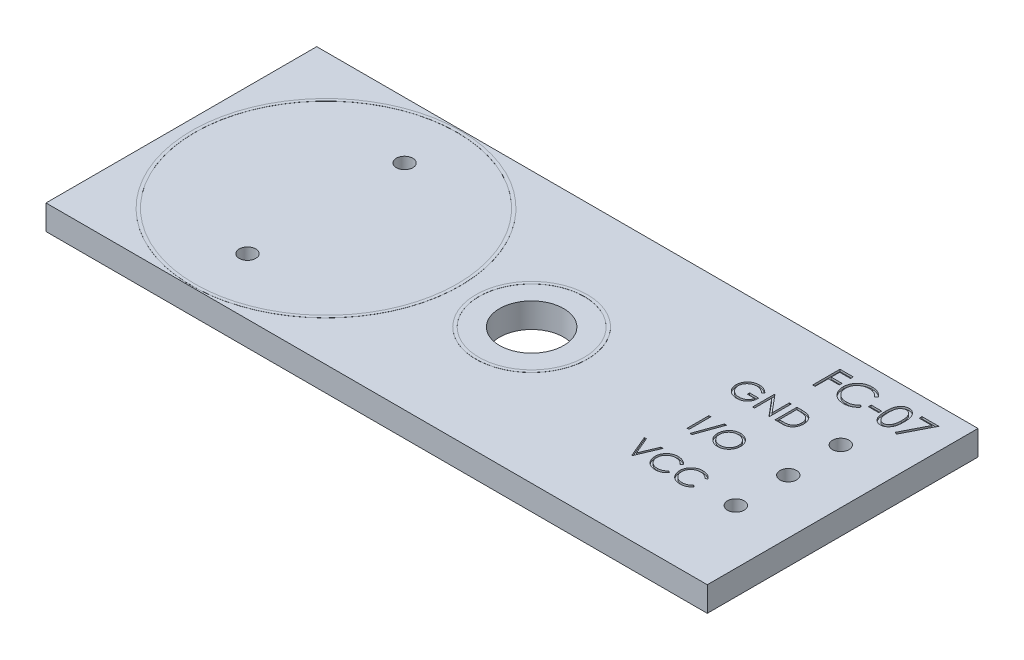
from build123d import *

# Parameters (mm, degrees)
SKETCH1_W           = 32
SKETCH1_H           = 13.1
BOSS_EXTRUDE1_DEPTH = 1.2
CUT_EXTRUDE1_REACH  = 19.33
SKETCH2_R           = 1.55
CUT_EXTRUDE2_REACH  = 19.33
SKETCH4_R           = 0.4
CUT_EXTRUDE3_REACH  = 19.33
SKETCH5_R           = 0.4
SKETCH6_W           = 0.094978632
SKETCH6_H           = 1.058333333
CUT_EXTRUDE4_DEPTH  = 0.1
SKETCH7_W           = 0.508814102
SKETCH7_H           = 0.13568376
CUT_EXTRUDE5_DEPTH  = 0.1
SKETCH8_R           = 6.5
SKETCH8_R_2         = 6.35
SKETCH8_R_3         = 2.7
SKETCH8_R_4         = 2.55
BOSS_EXTRUDE2_DEPTH = 0.005


with BuildPart() as part:
    # Sketch1 → Boss-Extrude1 (new body)
    with BuildSketch(Plane(origin=(0, 0, 0), x_dir=(1, 0, 0), z_dir=(0, 1, 0))):
        Rectangle(SKETCH1_W, SKETCH1_H)
    extrude(amount=BOSS_EXTRUDE1_DEPTH)

    # Sketch2 → Cut-Extrude1 (cut, up to next)
    with BuildSketch(Plane(origin=(0, 1.2, 0), x_dir=(1, 0, 0), z_dir=(0, 1, 0)), mode=Mode.PRIVATE) as cut_extrude1_sk1:
        with Locations((0.95, 0)):
            Circle(SKETCH2_R)
    cut_extrude1_tool1 = extrude(cut_extrude1_sk1.sketch, amount=-CUT_EXTRUDE1_REACH, mode=Mode.PRIVATE) & part.part
    add(cut_extrude1_tool1.solids().sort_by_distance((0.95, 1.2, 0))[0], mode=Mode.SUBTRACT)

    # Sketch4 → Cut-Extrude2 (cut, up to next)
    with BuildSketch(Plane(origin=(0, 1.2, 0), x_dir=(1, 0, 0), z_dir=(0, 1, 0)), mode=Mode.PRIVATE) as cut_extrude2_sk1:
        with Locations((13.37, 0)):
            Circle(SKETCH4_R)
    cut_extrude2_tool1 = extrude(cut_extrude2_sk1.sketch, amount=-CUT_EXTRUDE2_REACH, mode=Mode.PRIVATE) & part.part
    # Sketch4 → Cut-Extrude2 (cut, up to next)
    with BuildSketch(Plane(origin=(0, 1.2, 0), x_dir=(1, 0, 0), z_dir=(0, 1, 0)), mode=Mode.PRIVATE) as cut_extrude2_sk2:
        with Locations((13.37, 2.54)):
            Circle(SKETCH4_R)
    cut_extrude2_tool2 = extrude(cut_extrude2_sk2.sketch, amount=-CUT_EXTRUDE2_REACH, mode=Mode.PRIVATE) & part.part
    # Sketch4 → Cut-Extrude2 (cut, up to next)
    with BuildSketch(Plane(origin=(0, 1.2, 0), x_dir=(1, 0, 0), z_dir=(0, 1, 0)), mode=Mode.PRIVATE) as cut_extrude2_sk3:
        with Locations((13.37, -2.54)):
            Circle(SKETCH4_R)
    cut_extrude2_tool3 = extrude(cut_extrude2_sk3.sketch, amount=-CUT_EXTRUDE2_REACH, mode=Mode.PRIVATE) & part.part
    add(cut_extrude2_tool1.solids().sort_by_distance((13.37, 1.2, 0))[0], mode=Mode.SUBTRACT)
    add(cut_extrude2_tool2.solids().sort_by_distance((13.37, 1.2, -2.54))[0], mode=Mode.SUBTRACT)
    add(cut_extrude2_tool3.solids().sort_by_distance((13.37, 1.2, 2.54))[0], mode=Mode.SUBTRACT)

    # Sketch5 → Cut-Extrude3 (cut, up to next)
    with BuildSketch(Plane(origin=(0, 1.2, 0), x_dir=(1, 0, 0), z_dir=(0, 1, 0)), mode=Mode.PRIVATE) as cut_extrude3_sk1:
        with Locations((-9, -3.8)):
            Circle(SKETCH5_R)
    cut_extrude3_tool1 = extrude(cut_extrude3_sk1.sketch, amount=-CUT_EXTRUDE3_REACH, mode=Mode.PRIVATE) & part.part
    # Sketch5 → Cut-Extrude3 (cut, up to next)
    with BuildSketch(Plane(origin=(0, 1.2, 0), x_dir=(1, 0, 0), z_dir=(0, 1, 0)), mode=Mode.PRIVATE) as cut_extrude3_sk2:
        with Locations((-9, 3.8)):
            Circle(SKETCH5_R)
    cut_extrude3_tool2 = extrude(cut_extrude3_sk2.sketch, amount=-CUT_EXTRUDE3_REACH, mode=Mode.PRIVATE) & part.part
    add(cut_extrude3_tool1.solids().sort_by_distance((-9, 1.2, 3.8))[0], mode=Mode.SUBTRACT)
    add(cut_extrude3_tool2.solids().sort_by_distance((-9, 1.2, -3.8))[0], mode=Mode.SUBTRACT)

    # Sketch6 → Cut-Extrude4 (cut)
    # profile 1 of 9: a face of its own
    with BuildSketch(Plane(origin=(0, 1.2, 0), x_dir=(1, 0, 0), z_dir=(0, 1, 0))):
        with BuildLine():
            Line((9.359822658, 2.876299306), (9.278412401, 2.799129167))
            add(Edge.make_bspline(
                [(9.278412401, 2.799129167), (9.263680738, 2.812987547), (9.234568695, 2.840373846), (9.187106907, 2.875906933), (9.137587904, 2.906346444), (9.086270077, 2.93111333), (9.034424276, 2.95087476), (8.98273867, 2.964943983), (8.931743422, 2.973916393), (8.897826192, 2.974989353), (8.88111339, 2.975518056)],
                knots=[0, 0, 0, 0, 1.08915593, 2.152340314, 3.188132944, 4.216796309, 5.218260357, 6.173443236, 7.099959455, 8, 8, 8, 8], degree=3))
            add(Edge.make_bspline(
                [(8.88111339, 2.975518056), (8.87085823, 2.97539299), (8.850374509, 2.975143181), (8.81994835, 2.971954811), (8.789841295, 2.967369245), (8.760110179, 2.960734439), (8.730697195, 2.952325509), (8.70170464, 2.941807048), (8.67307843, 2.929543914), (8.64508821, 2.915373595), (8.617952391, 2.89980707), (8.592323539, 2.882556678), (8.568038297, 2.864175306), (8.54555312, 2.844202748), (8.524738671, 2.822819919), (8.505099521, 2.800424586), (8.487326386, 2.776404889), (8.471272629, 2.751202759), (8.456951378, 2.725260835), (8.444309237, 2.698828812), (8.433696546, 2.671994361), (8.425299592, 2.644723809), (8.418371847, 2.617228131), (8.413498189, 2.589316941), (8.410750537, 2.560960356), (8.410275261, 2.541971661), (8.410036333, 2.532425775)],
                knots=[0, 0, 0, 0, 1.02818874, 2.053710826, 3.065248034, 4.081641283, 5.106893873, 6.131558223, 7.173050175, 8.228653731, 9.27666206, 10.308777013, 11.325269123, 12.329503258, 13.32196095, 14.316845687, 15.314881793, 16.315733098, 17.311955233, 18.285320748, 19.252783886, 20.203351036, 21.145449891, 22.095197417, 23.042428769, 24, 24, 24, 24], degree=3))
            add(Edge.make_bspline(
                [(8.410036333, 2.532425775), (8.410264848, 2.522667695), (8.410721253, 2.50317818), (8.41364235, 2.474090925), (8.419063508, 2.445435672), (8.426310887, 2.41711826), (8.435376515, 2.389090192), (8.446677297, 2.361472981), (8.460062371, 2.334267649), (8.475555329, 2.307719321), (8.492544967, 2.281858788), (8.511577755, 2.257499123), (8.531795122, 2.234315945), (8.553933611, 2.212823988), (8.57728333, 2.192448382), (8.602541899, 2.173750498), (8.629212643, 2.156370178), (8.657336252, 2.140526468), (8.68660757, 2.126372459), (8.716620921, 2.113786185), (8.747472189, 2.103420767), (8.778999241, 2.094972816), (8.811164492, 2.088048202), (8.844131213, 2.083593381), (8.877657008, 2.080360677), (8.900256547, 2.080124315), (8.911642236, 2.080005236)],
                knots=[0, 0, 0, 0, 0.93586088, 1.869166235, 2.799637598, 3.729985548, 4.670839027, 5.622275134, 6.589130586, 7.576015415, 8.568469353, 9.55398029, 10.53834874, 11.515998671, 12.510579167, 13.508179873, 14.527009472, 15.561807829, 16.601455013, 17.643573243, 18.680854198, 19.719860599, 20.772568776, 21.833555941, 22.908541556, 24, 24, 24, 24], degree=3))
            add(Edge.make_bspline(
                [(8.911642236, 2.080005236), (8.925363784, 2.080292067), (8.952308272, 2.080855307), (8.991916077, 2.085239918), (9.02995653, 2.092087877), (9.066322739, 2.102116613), (9.101056943, 2.114908438), (9.134286475, 2.130328472), (9.165749715, 2.148968159), (9.195541246, 2.170005971), (9.22298449, 2.19344498), (9.247735618, 2.21873747), (9.269399849, 2.245760671), (9.28830008, 2.274355421), (9.303935792, 2.304758406), (9.316769685, 2.336820633), (9.326607132, 2.370556524), (9.330645422, 2.393867565), (9.332685906, 2.405646261)],
                knots=[0, 0, 0, 0, 1.13008108, 2.219097802, 3.278683437, 4.311054135, 5.322181354, 6.324827112, 7.324222904, 8.330512327, 9.32562643, 10.293043162, 11.24128371, 12.174520618, 13.111833804, 14.052305215, 15.015860969, 16, 16, 16, 16], degree=3))
            Line((9.332685906, 2.405646261), (8.979908128, 2.405646261))
            Line((8.979908128, 2.405646261), (8.979908128, 2.51419327))
            Line((8.979908128, 2.51419327), (9.427664538, 2.51419327))
            add(Edge.make_bspline(
                [(9.427664538, 2.51419327), (9.427148722, 2.49396172), (9.426139177, 2.454364921), (9.419057743, 2.396619149), (9.40762275, 2.342078184), (9.392001655, 2.290684589), (9.371779845, 2.242511193), (9.347174342, 2.197509086), (9.317791343, 2.155968994), (9.284677472, 2.117551796), (9.247514866, 2.0832832), (9.207307688, 2.053164262), (9.163989509, 2.027793709), (9.117601305, 2.007152985), (9.068294936, 1.991043944), (9.015956307, 1.979622539), (8.960656394, 1.972779669), (8.922756971, 1.971905371), (8.903374007, 1.971458227)],
                knots=[0, 0, 0, 0, 1.140356446, 2.231883559, 3.274166699, 4.278491846, 5.25512956, 6.21435461, 7.1637429, 8.11826594, 9.068280886, 10.0076534, 10.945064095, 11.891975133, 12.864533718, 13.863980011, 14.907571808, 16, 16, 16, 16], degree=3))
            add(Edge.make_bspline(
                [(8.903374007, 1.971458227), (8.891426894, 1.971630318), (8.867863338, 1.971969738), (8.833062034, 1.974381936), (8.799220277, 1.978095348), (8.766342998, 1.983703041), (8.734309261, 1.990571519), (8.703279053, 1.999366789), (8.67313417, 2.009547562), (8.643828017, 2.021127445), (8.615626594, 2.034544588), (8.58840429, 2.049454884), (8.562010629, 2.065781448), (8.536625395, 2.083806632), (8.512116324, 2.103395614), (8.488641449, 2.124587656), (8.466069353, 2.147317971), (8.451929879, 2.163458767), (8.444805297, 2.171591774)],
                knots=[0, 0, 0, 0, 1.107784379, 2.184907829, 3.233506516, 4.263428166, 5.276301166, 6.270063455, 7.25232949, 8.225834625, 9.190232166, 10.146266622, 11.1027726, 12.066435141, 13.031522626, 14.010570082, 14.99756817, 16, 16, 16, 16], degree=3))
            add(Edge.make_bspline(
                [(8.444805297, 2.171591774), (8.434468122, 2.184494567), (8.413965359, 2.210085979), (8.387574107, 2.251088819), (8.36507654, 2.293543668), (8.34682246, 2.33756871), (8.332568801, 2.383122767), (8.322346434, 2.430147629), (8.316357087, 2.478703851), (8.315494232, 2.511562157), (8.3150577, 2.528185658)],
                knots=[0, 0, 0, 0, 1.023165419, 2.029347347, 3.013907458, 3.994755782, 4.975994455, 5.96558838, 6.970761222, 8, 8, 8, 8], degree=3))
            add(Edge.make_bspline(
                [(8.3150577, 2.528185658), (8.315218639, 2.540633548), (8.315538471, 2.565371125), (8.319416663, 2.602097501), (8.324980901, 2.638171758), (8.333159415, 2.673564407), (8.343469476, 2.708299086), (8.35633684, 2.742391923), (8.371318273, 2.775863036), (8.38873103, 2.808482039), (8.40810895, 2.839816088), (8.429139612, 2.869739043), (8.452121653, 2.897705974), (8.476679763, 2.924071068), (8.503106949, 2.9485031), (8.531155631, 2.971228272), (8.560847428, 2.992277066), (8.592275749, 3.011317944), (8.624971501, 3.028421706), (8.658856311, 3.043416539), (8.693919835, 3.055809113), (8.729899382, 3.066324042), (8.767067293, 3.07409981), (8.805153848, 3.079738836), (8.844357573, 3.083597398), (8.870857039, 3.083907718), (8.884293478, 3.084065065)],
                knots=[0, 0, 0, 0, 1.008945113, 2.00506715, 2.99143336, 3.967273523, 4.948097931, 5.927297278, 6.919902385, 7.919676788, 8.923139349, 9.905703106, 10.883022732, 11.856032218, 12.825136022, 13.798837087, 14.781400844, 15.773989409, 16.776158564, 17.77167057, 18.775803737, 19.789618931, 20.80898985, 21.851988756, 22.910860228, 24, 24, 24, 24], degree=3))
            add(Edge.make_bspline(
                [(8.884293478, 3.084065065), (8.895251232, 3.083889837), (8.916979172, 3.083542382), (8.949311477, 3.081134024), (8.981144031, 3.077316803), (9.012524035, 3.072107751), (9.043344627, 3.065012778), (9.073693607, 3.05652244), (9.103614969, 3.046637055), (9.133014939, 3.034847571), (9.162091201, 3.021466117), (9.191005424, 3.006403487), (9.219658815, 2.989402117), (9.248101064, 2.970411524), (9.276511526, 2.949757871), (9.304440835, 2.926850451), (9.332563154, 2.902592618), (9.350646083, 2.885150624), (9.359822658, 2.876299306)],
                knots=[0, 0, 0, 0, 0.985871117, 1.954866573, 2.915460327, 3.869826059, 4.81536089, 5.759505086, 6.70452669, 7.649098992, 8.607881297, 9.583363685, 10.581137262, 11.603961102, 12.659522466, 13.73993555, 14.853081303, 16, 16, 16, 16], degree=3))
        make_face()
    # profile 2 of 9: a face of its own
    with BuildSketch(Plane(origin=(0, 1.2, 0), x_dir=(1, 0, 0), z_dir=(0, 1, 0))):
        Polygon((9.644758555, 1.998594979), (9.644758555, 3.056928312), (9.664687108, 3.056928312), (10.363882487, 2.223957225), (10.363882487, 3.056928312), (10.458861119, 3.056928312), (10.458861119, 1.998594979), (10.43723652, 1.998594979), (9.739737188, 2.829658013), (9.739737188, 1.998594979), align=None)
    # profile 3 of 9: a face of its own
    with BuildSketch(Plane(origin=(0, 1.2, 0), x_dir=(1, 0, 0), z_dir=(0, 1, 0))):
        with BuildLine():
            Line((10.730228641, 1.998594979), (10.730228641, 3.056928312))
            Line((10.730228641, 3.056928312), (10.943930564, 3.056928312))
            add(Edge.make_bspline(
                [(10.943930564, 3.056928312), (10.962517615, 3.056794488), (10.998427701, 3.056535939), (11.050320036, 3.054896614), (11.098333222, 3.051996639), (11.142309348, 3.047772521), (11.182369143, 3.04258577), (11.218400437, 3.036084457), (11.250589537, 3.028407558), (11.270386249, 3.021862386), (11.279747871, 3.018767255)],
                knots=[0, 0, 0, 0, 1.314313732, 2.53924729, 3.670748893, 4.714932338, 5.66265055, 6.526160246, 7.303039223, 8, 8, 8, 8], degree=3))
            add(Edge.make_bspline(
                [(11.279747871, 3.018767255), (11.291992709, 3.014101303), (11.316204713, 3.004875209), (11.350678295, 2.987471279), (11.38313144, 2.96775208), (11.413738182, 2.945691616), (11.441799384, 2.920665254), (11.468411296, 2.893736088), (11.492485272, 2.863924851), (11.514531352, 2.831849795), (11.534408563, 2.79788877), (11.551686356, 2.762106487), (11.56603554, 2.724684665), (11.577947301, 2.68572737), (11.587335158, 2.645148942), (11.593740171, 2.60290213), (11.597964732, 2.559153899), (11.598389291, 2.529467811), (11.598604709, 2.514405276)],
                knots=[0, 0, 0, 0, 0.984719456, 1.947108742, 2.898477687, 3.838006223, 4.779231079, 5.722358779, 6.681677486, 7.655904652, 8.64651281, 9.637519902, 10.640069247, 11.656948941, 12.698408672, 13.768548281, 14.867775369, 16, 16, 16, 16], degree=3))
            add(Edge.make_bspline(
                [(11.598604709, 2.514405276), (11.598414521, 2.501323901), (11.598039736, 2.475545686), (11.594674443, 2.437554273), (11.589783032, 2.400689931), (11.582210144, 2.365128207), (11.573017003, 2.330557532), (11.561234986, 2.297346353), (11.547738062, 2.265190011), (11.53199917, 2.234523298), (11.514720703, 2.205469516), (11.496178176, 2.178081202), (11.476391366, 2.15274917), (11.455171591, 2.129396709), (11.432793068, 2.108059022), (11.409109282, 2.088557865), (11.384059121, 2.071274812), (11.357754784, 2.05553071), (11.329428907, 2.04179646), (11.298544966, 2.030175957), (11.264971253, 2.020546147), (11.228790175, 2.012511614), (11.189939219, 2.006138239), (11.148380294, 2.001866687), (11.104177251, 1.998978062), (11.073824473, 1.998725153), (11.058201731, 1.998594979)],
                knots=[0, 0, 0, 0, 1.105936401, 2.179363191, 3.223086493, 4.248585256, 5.251745608, 6.245858792, 7.225916811, 8.198733463, 9.158002045, 10.082870192, 10.993790845, 11.873723703, 12.748670949, 13.606408763, 14.465103618, 15.319838547, 16.196477973, 17.123216899, 18.106603292, 19.147568657, 20.255746949, 21.433717677, 22.679120308, 24, 24, 24, 24], degree=3))
            Line((11.058201731, 1.998594979), (10.730228641, 1.998594979))
        make_face()
        with BuildLine():
            Line((10.825207273, 2.107141988), (10.94668664, 2.107141988))
            add(Edge.make_bspline(
                [(10.94668664, 2.107141988), (10.9641426, 2.107217007), (10.997716803, 2.107361297), (11.04599434, 2.108627428), (11.090105491, 2.1106963), (11.130056519, 2.113591621), (11.165824867, 2.117422369), (11.197485287, 2.12169347), (11.224933996, 2.127014604), (11.241543611, 2.13183787), (11.249219025, 2.134066734)],
                knots=[0, 0, 0, 0, 1.375205317, 2.645023457, 3.804390687, 4.853969522, 5.800190428, 6.637939096, 7.370582563, 8, 8, 8, 8], degree=3))
            add(Edge.make_bspline(
                [(11.249219025, 2.134066734), (11.258879601, 2.137468991), (11.277970011, 2.144192242), (11.30545072, 2.156456106), (11.331079624, 2.170983113), (11.35530337, 2.187130943), (11.377778335, 2.205469139), (11.398770865, 2.225598938), (11.418238695, 2.247622787), (11.435980688, 2.27151335), (11.451858199, 2.297121931), (11.465607833, 2.324196769), (11.477658177, 2.352441209), (11.487116228, 2.382288978), (11.494529274, 2.413473241), (11.499780024, 2.445996192), (11.503050191, 2.479851755), (11.503431629, 2.502878707), (11.503626077, 2.514617281)],
                knots=[0, 0, 0, 0, 0.998632004, 1.973411704, 2.929992603, 3.868527914, 4.809262121, 5.754881198, 6.702106254, 7.672490631, 8.653608572, 9.636854334, 10.631411391, 11.644891563, 12.686317036, 13.754757253, 14.855430412, 16, 16, 16, 16], degree=3))
            add(Edge.make_bspline(
                [(11.503626077, 2.514617281), (11.503470868, 2.526994786), (11.50316596, 2.551310504), (11.49933349, 2.586988643), (11.493732924, 2.62130303), (11.485634048, 2.65425596), (11.47531352, 2.685911724), (11.462433712, 2.716095243), (11.447717853, 2.745125286), (11.430208987, 2.772331821), (11.41103332, 2.798062356), (11.389752389, 2.821634438), (11.366704297, 2.843101762), (11.342140426, 2.862798649), (11.315368493, 2.879932665), (11.287019163, 2.895259352), (11.256676543, 2.908266539), (11.235566514, 2.915184671), (11.22483835, 2.918700481)],
                knots=[0, 0, 0, 0, 1.122418816, 2.205001699, 3.251619955, 4.274784885, 5.280384055, 6.268708349, 7.249350384, 8.229342522, 9.199999885, 10.157847722, 11.105861043, 12.055065948, 13.010012805, 13.98527497, 14.976112212, 16, 16, 16, 16], degree=3))
            add(Edge.make_bspline(
                [(11.22483835, 2.918700481), (11.215963122, 2.921154734), (11.197091953, 2.92637315), (11.166297639, 2.932065584), (11.131640201, 2.937086468), (11.092965767, 2.941337352), (11.050318424, 2.944387566), (11.00366537, 2.946676987), (10.952986442, 2.948221135), (10.917855057, 2.948326578), (10.899621336, 2.948381304)],
                knots=[0, 0, 0, 0, 0.674548936, 1.434276114, 2.292660221, 3.240891867, 4.284742987, 5.42552168, 6.663806718, 8, 8, 8, 8], degree=3))
            Line((10.899621336, 2.948381304), (10.825207273, 2.948381304))
            Line((10.825207273, 2.948381304), (10.825207273, 2.107141988))
        make_face(mode=Mode.SUBTRACT)
    # profile 4 of 9: a face of its own
    with BuildSketch(Plane(origin=(0, 1.2, 0), x_dir=(1, 0, 0), z_dir=(0, 1, 0))):
        with Locations((9.000260692, 0.046631621)):
            Rectangle(SKETCH6_W, SKETCH6_H)
    # profile 5 of 9: a face of its own
    with BuildSketch(Plane(origin=(0, 1.2, 0), x_dir=(1, 0, 0), z_dir=(0, 1, 0))):
        Polygon((9.780442316, 0.60293504), (9.337774047, -0.631787182), (9.237707273, -0.631787182), (9.680375542, 0.60293504), align=None)
    # profile 6 of 9: a face of its own
    with BuildSketch(Plane(origin=(0, 1.2, 0), x_dir=(1, 0, 0), z_dir=(0, 1, 0))):
        with BuildLine():
            add(Edge.make_bspline(
                [(10.452076931, 0.60293504), (10.471673668, 0.602438688), (10.510163276, 0.601463812), (10.566731162, 0.594001321), (10.620734917, 0.581091048), (10.672614459, 0.563896765), (10.72174924, 0.540959844), (10.768509095, 0.513236002), (10.812782769, 0.480434787), (10.85397352, 0.442809759), (10.891667407, 0.401872381), (10.924876663, 0.358185013), (10.9527085, 0.312011804), (10.975564202, 0.263491505), (10.993494972, 0.212733848), (11.005868112, 0.159468233), (11.01377179, 0.104039781), (11.014695799, 0.066234039), (11.015164538, 0.047055633)],
                knots=[0, 0, 0, 0, 1.065120563, 2.091984664, 3.0946048, 4.079830382, 5.057816894, 6.036188127, 7.030412546, 8.04752943, 9.064399622, 10.05169764, 11.02544977, 11.989514704, 12.962713494, 13.945757189, 14.957906945, 16, 16, 16, 16], degree=3))
            add(Edge.make_bspline(
                [(11.015164538, 0.047055633), (11.014695868, 0.028018501), (11.013772065, -0.009505893), (11.005859125, -0.064582601), (10.993449108, -0.117526693), (10.975730714, -0.168249783), (10.952983962, -0.21680538), (10.924966803, -0.263065721), (10.89196458, -0.307045971), (10.854406794, -0.348264325), (10.813464098, -0.386061179), (10.769549231, -0.418996172), (10.723649823, -0.447336562), (10.675175221, -0.469949721), (10.624768305, -0.488023611), (10.571977935, -0.50034643), (10.517051477, -0.508295131), (10.479595245, -0.509207873), (10.460557166, -0.509671797)],
                knots=[0, 0, 0, 0, 1.043624062, 2.057103931, 3.04512605, 4.022047818, 4.998200453, 5.980619268, 6.982898556, 8.009068085, 9.034988726, 10.034168286, 11.015286542, 11.987931943, 12.962482838, 13.94673481, 14.956375938, 16, 16, 16, 16], degree=3))
            add(Edge.make_bspline(
                [(10.460557166, -0.509671797), (10.44137886, -0.509203292), (10.403573314, -0.508279744), (10.34807521, -0.500362986), (10.294772178, -0.487983115), (10.243816648, -0.470290976), (10.195180205, -0.447425766), (10.148767728, -0.419544918), (10.10476551, -0.386462283), (10.063538363, -0.348916676), (10.025816581, -0.308043373), (9.992929818, -0.264248253), (9.9650427, -0.218390532), (9.942254264, -0.170342947), (9.924212868, -0.120337773), (9.911904506, -0.068041447), (9.903941016, -0.01375212), (9.903023336, 0.023211804), (9.9025577, 0.041967492)],
                knots=[0, 0, 0, 0, 1.053102029, 2.075944431, 3.073151272, 4.055350789, 5.033113405, 6.020478099, 7.024410459, 8.052272461, 9.079885166, 10.07527673, 11.055994387, 12.023226415, 12.992069828, 13.970394897, 14.97016774, 16, 16, 16, 16], degree=3))
            add(Edge.make_bspline(
                [(9.9025577, 0.041967492), (9.902719364, 0.054556418), (9.903040652, 0.079575456), (9.906908616, 0.116727975), (9.912521321, 0.153283008), (9.920565232, 0.189136604), (9.93108557, 0.224200997), (9.943498921, 0.258718013), (9.958660255, 0.292337853), (9.975799404, 0.325219784), (9.994928569, 0.356851222), (10.016057665, 0.386750524), (10.03844455, 0.415168588), (10.062986814, 0.441368991), (10.088875597, 0.46611393), (10.116530868, 0.489023133), (10.14578388, 0.510303177), (10.176760505, 0.529480281), (10.208697459, 0.54682459), (10.241619723, 0.561708341), (10.275080162, 0.574482745), (10.309235496, 0.584836518), (10.343995025, 0.593010491), (10.379434612, 0.598576524), (10.415526024, 0.602454354), (10.439840876, 0.602774122), (10.452076931, 0.60293504)],
                knots=[0, 0, 0, 0, 1.037015668, 2.060948919, 3.074880161, 4.083647147, 5.086022904, 6.090072063, 7.104153813, 8.122640571, 9.144368836, 10.147691507, 11.138137339, 12.123020368, 13.103399296, 14.087645067, 15.080126199, 16.082011238, 17.087798457, 18.072939717, 19.057185487, 20.037253025, 21.01195951, 21.997135196, 22.992090687, 24, 24, 24, 24], degree=3))
        make_face()
        with BuildLine():
            add(Edge.make_bspline(
                [(10.456741061, 0.494388032), (10.446697588, 0.494265601), (10.426706659, 0.494021909), (10.396987288, 0.490811919), (10.367658774, 0.486236928), (10.338715062, 0.479711088), (10.310277256, 0.470819862), (10.28208028, 0.460587016), (10.254381261, 0.448122544), (10.227271642, 0.434039845), (10.200990179, 0.418452433), (10.1761911, 0.401225256), (10.152810206, 0.382762312), (10.130904742, 0.363020514), (10.11053903, 0.341899325), (10.091312228, 0.319718945), (10.073994997, 0.295845397), (10.058124358, 0.27092606), (10.043922178, 0.244993391), (10.03129313, 0.218320409), (10.020962585, 0.190689537), (10.012537533, 0.162400542), (10.00555259, 0.133498227), (10.00112757, 0.103763339), (9.997882309, 0.073345293), (9.997652546, 0.052788875), (9.997536333, 0.042391504)],
                knots=[0, 0, 0, 0, 1.008559885, 2.007477868, 2.99961109, 3.989939068, 4.984837346, 5.991145699, 7.001802488, 8.033829008, 9.059044045, 10.069351652, 11.065060232, 12.050310815, 13.029377138, 14.011219647, 14.996725999, 15.989392538, 16.977580475, 17.965360261, 18.951710183, 19.937753436, 20.929683414, 21.935841486, 22.955955122, 24, 24, 24, 24], degree=3))
            add(Edge.make_bspline(
                [(9.997536333, 0.042391504), (9.997921827, 0.027102452), (9.998680213, -0.002975845), (10.005319764, -0.047053355), (10.015546885, -0.089413384), (10.030622803, -0.129824152), (10.049476441, -0.168633018), (10.072767905, -0.205495707), (10.100362914, -0.240422181), (10.13170879, -0.273168608), (10.165975418, -0.303057696), (10.202361744, -0.329293298), (10.240477954, -0.35149116), (10.280423446, -0.369575074), (10.321984964, -0.383904828), (10.365430318, -0.393725748), (10.4104701, -0.400189278), (10.441171036, -0.400809993), (10.456741061, -0.401124789)],
                knots=[0, 0, 0, 0, 1.032063989, 2.030389145, 3.003944642, 3.970395727, 4.937377036, 5.913328081, 6.909231446, 7.93887556, 8.970685674, 9.976071282, 10.964166581, 11.944589148, 12.933237628, 13.927779006, 14.949070134, 16, 16, 16, 16], degree=3))
            add(Edge.make_bspline(
                [(10.456741061, -0.401124789), (10.467206315, -0.400981005), (10.487962057, -0.400695839), (10.518833798, -0.397823621), (10.549149367, -0.393217793), (10.578866242, -0.386586381), (10.607950697, -0.378286868), (10.636524125, -0.368426913), (10.66428218, -0.356125691), (10.691575035, -0.342534287), (10.717699613, -0.327040239), (10.742638643, -0.310397751), (10.765763523, -0.291962002), (10.787652599, -0.27251352), (10.808101924, -0.251660166), (10.826973212, -0.229429052), (10.844202919, -0.205679853), (10.860067531, -0.180798314), (10.874219946, -0.154794685), (10.886550769, -0.128024996), (10.897011975, -0.100555166), (10.905457023, -0.072345571), (10.91207477, -0.043449791), (10.916634651, -0.013829134), (10.919824298, 0.016457143), (10.920064714, 0.036941595), (10.920185906, 0.047267639)],
                knots=[0, 0, 0, 0, 1.047197238, 2.076906641, 3.100256066, 4.114471768, 5.12198147, 6.126382909, 7.136867548, 8.15857795, 9.17633901, 10.174870724, 11.156907918, 12.133735059, 13.104061851, 14.077631395, 15.04955518, 16.038496417, 17.029181396, 18.010275684, 18.986308667, 19.968651475, 20.955262928, 21.950658345, 22.966943676, 24, 24, 24, 24], degree=3))
            add(Edge.make_bspline(
                [(10.920185906, 0.047267639), (10.920064617, 0.057523042), (10.919824018, 0.077866522), (10.916636174, 0.107941579), (10.912069953, 0.137349097), (10.905489324, 0.165973628), (10.897007492, 0.193822468), (10.886548942, 0.220869461), (10.874216244, 0.247215367), (10.860062329, 0.272795071), (10.844152306, 0.297340766), (10.826767142, 0.320806257), (10.807606668, 0.342750872), (10.787218322, 0.363716363), (10.76509284, 0.383255582), (10.741330446, 0.401375011), (10.71621962, 0.418511929), (10.689632099, 0.433971325), (10.662192856, 0.44824801), (10.634036968, 0.460479623), (10.605483407, 0.470873097), (10.576604783, 0.479737989), (10.547158025, 0.486211369), (10.517342106, 0.490816042), (10.487198275, 0.494020792), (10.466925682, 0.49426523), (10.456741061, 0.494388032)],
                knots=[0, 0, 0, 0, 1.02996197, 2.043119294, 3.035359645, 4.018872909, 4.991431989, 5.957985074, 6.929999688, 7.912076566, 8.892894881, 9.867085534, 10.843653904, 11.817741046, 12.803660682, 13.806313499, 14.818574707, 15.856120519, 16.894564902, 17.924820532, 18.937903209, 19.946497019, 20.957711757, 21.963978472, 22.977135795, 24, 24, 24, 24], degree=3))
        make_face(mode=Mode.SUBTRACT)
    # profile 7 of 9: a face of its own
    with BuildSketch(Plane(origin=(0, 1.2, 0), x_dir=(1, 0, 0), z_dir=(0, 1, 0))):
        Polygon((8.308273512, -1.905331736), (8.410036333, -1.905331736), (8.762814111, -2.739362853), (9.115591888, -1.905331736), (9.217354709, -1.905331736), (8.769598299, -2.963665069), (8.756029923, -2.963665069), align=None)
    # profile 8 of 9: a face of its own
    with BuildSketch(Plane(origin=(0, 1.2, 0), x_dir=(1, 0, 0), z_dir=(0, 1, 0))):
        with BuildLine():
            Line((10.384235051, -2.099529119), (10.301128747, -2.163130881))
            add(Edge.make_bspline(
                [(10.301128747, -2.163130881), (10.2952003, -2.156065457), (10.283423334, -2.142029866), (10.264476385, -2.122320813), (10.244730412, -2.103855841), (10.224192963, -2.086546987), (10.202494372, -2.070999537), (10.180160274, -2.056403275), (10.156817055, -2.043319935), (10.124537364, -2.027456127), (10.082310515, -2.010901933), (10.029153504, -1.99702167), (9.973663243, -1.988185743), (9.935805874, -1.987228755), (9.916550088, -1.986741993)],
                knots=[0, 0, 0, 0, 0.757959112, 1.505699292, 2.245454638, 2.979532153, 3.711538275, 4.438200793, 5.171680507, 5.909471876, 7.393775596, 8.890124382, 10.418191784, 12, 12, 12, 12], degree=3))
            add(Edge.make_bspline(
                [(9.916550088, -1.986741993), (9.905941567, -1.986864143), (9.884822981, -1.987107311), (9.853481657, -1.990315308), (9.822725568, -1.994824174), (9.792574719, -2.00151445), (9.763067492, -2.009972837), (9.734010979, -2.020080046), (9.70582587, -2.032584962), (9.678122259, -2.046406269), (9.651579498, -2.062017425), (9.626465234, -2.07904551), (9.602871062, -2.097299975), (9.58077832, -2.116849238), (9.560164421, -2.137605259), (9.541178735, -2.159789239), (9.523886956, -2.183330253), (9.507946331, -2.207917879), (9.4936701, -2.233480497), (9.481717018, -2.26011272), (9.471132135, -2.287358485), (9.462756412, -2.315525621), (9.456126856, -2.344415934), (9.451552539, -2.374106958), (9.448381025, -2.404536666), (9.448139066, -2.425161863), (9.448017102, -2.435558432)],
                knots=[0, 0, 0, 0, 1.054917814, 2.100044995, 3.131103042, 4.146048494, 5.169673617, 6.183595914, 7.203665975, 8.234915748, 9.262203917, 10.264457458, 11.251630812, 12.227803204, 13.197192746, 14.159520551, 15.12972552, 16.100847026, 17.073214652, 18.039054194, 19.002613845, 19.979014051, 20.95965708, 21.949030935, 22.966165397, 24, 24, 24, 24], degree=3))
            add(Edge.make_bspline(
                [(9.448017102, -2.435558432), (9.448398652, -2.451200998), (9.449147775, -2.481913101), (9.455814771, -2.5268985), (9.465946073, -2.569994037), (9.481130307, -2.610930323), (9.499853448, -2.650212136), (9.523511919, -2.687174837), (9.550912634, -2.722376988), (9.582443232, -2.754986641), (9.617037372, -2.784775316), (9.654154002, -2.811007039), (9.693700679, -2.832873682), (9.735240756, -2.851069742), (9.77909389, -2.865056895), (9.825181223, -2.874903666), (9.873402517, -2.881326897), (9.906352788, -2.881941845), (9.92312227, -2.882254813)],
                knots=[0, 0, 0, 0, 1.029171465, 2.020641659, 2.987623507, 3.938342917, 4.889210282, 5.84687017, 6.821220943, 7.821438502, 8.827599549, 9.822697543, 10.807740252, 11.797342354, 12.80366471, 13.83203677, 14.896651826, 16, 16, 16, 16], degree=3))
            add(Edge.make_bspline(
                [(9.92312227, -2.882254813), (9.94159856, -2.881744158), (9.977964317, -2.880739067), (10.031294649, -2.872224247), (10.082347368, -2.858418162), (10.131125222, -2.839096647), (10.177490698, -2.813979287), (10.221516355, -2.783530167), (10.263239354, -2.747459647), (10.288328289, -2.719917844), (10.301128747, -2.705865924)],
                knots=[0, 0, 0, 0, 1.028121516, 2.023589091, 2.998037872, 3.967518031, 4.937445131, 5.927275754, 6.942489185, 8, 8, 8, 8], degree=3))
            Line((10.301128747, -2.705865924), (10.384235051, -2.768831669))
            add(Edge.make_bspline(
                [(10.384235051, -2.768831669), (10.377546956, -2.777461154), (10.364202801, -2.794678787), (10.342595258, -2.818951423), (10.319832837, -2.841782406), (10.295746468, -2.862987663), (10.270613231, -2.882991513), (10.243981841, -2.901225638), (10.216202395, -2.917944548), (10.187369017, -2.933253166), (10.157512341, -2.946835286), (10.126668143, -2.958462973), (10.094969374, -2.968479308), (10.062414585, -2.976719775), (10.028936249, -2.983151746), (9.994655177, -2.987451504), (9.959497381, -2.990397274), (9.935778189, -2.990665763), (9.923758288, -2.990801822)],
                knots=[0, 0, 0, 0, 0.986787822, 1.968848986, 2.935600012, 3.899624008, 4.868462664, 5.837806735, 6.815139263, 7.798259679, 8.787526145, 9.778297419, 10.776456485, 11.791383307, 12.812564526, 13.85620153, 14.913611965, 16, 16, 16, 16], degree=3))
            add(Edge.make_bspline(
                [(9.923758288, -2.990801822), (9.91237556, -2.9907226), (9.889867625, -2.990565949), (9.856636336, -2.988028318), (9.824284725, -2.984566135), (9.792905255, -2.979353048), (9.762326686, -2.973201307), (9.732826223, -2.964954999), (9.704113577, -2.955717512), (9.676304102, -2.944860528), (9.649374145, -2.932609207), (9.623410564, -2.918762711), (9.5984253, -2.903437481), (9.574172709, -2.886971323), (9.551011058, -2.868835329), (9.528739635, -2.849281371), (9.507233553, -2.828375353), (9.493927979, -2.813300195), (9.487238189, -2.805720692)],
                knots=[0, 0, 0, 0, 1.114604814, 2.203992996, 3.262667896, 4.300477797, 5.318619304, 6.316056647, 7.298880507, 8.271930387, 9.238335007, 10.195173496, 11.151986948, 12.108099108, 13.064862484, 14.031167946, 15.010108607, 16, 16, 16, 16], degree=3))
            add(Edge.make_bspline(
                [(9.487238189, -2.805720692), (9.476523126, -2.792554666), (9.45522236, -2.766381565), (9.42797007, -2.723961756), (9.404642119, -2.67967256), (9.385780828, -2.633281296), (9.371035907, -2.584892062), (9.360821117, -2.534480466), (9.35418337, -2.482093588), (9.353424306, -2.446461988), (9.35303847, -2.428350232)],
                knots=[0, 0, 0, 0, 0.994628077, 1.977248131, 2.950237994, 3.925870899, 4.908910175, 5.911660606, 6.938484602, 8, 8, 8, 8], degree=3))
            add(Edge.make_bspline(
                [(9.35303847, -2.428350232), (9.353508731, -2.409313702), (9.35443394, -2.371860518), (9.362294573, -2.316895537), (9.37493978, -2.264235471), (9.392900268, -2.213978625), (9.415671172, -2.165860659), (9.443800648, -2.120249152), (9.476961903, -2.076852405), (9.514894858, -2.036328897), (9.5564926, -1.999275331), (9.601039003, -1.966676788), (9.648446878, -1.93954792), (9.698193942, -1.916870509), (9.750652708, -1.899439922), (9.80571125, -1.887237887), (9.863266113, -1.879642949), (9.902534037, -1.878682827), (9.922486253, -1.878194984)],
                knots=[0, 0, 0, 0, 1.032925535, 2.032216505, 3.007276963, 3.968222605, 4.92396291, 5.891752235, 6.871517503, 7.883894988, 8.900124299, 9.891468569, 10.874487609, 11.85992873, 12.854644235, 13.869047385, 14.917252991, 16, 16, 16, 16], degree=3))
            add(Edge.make_bspline(
                [(9.922486253, -1.878194984), (9.934646343, -1.878340773), (9.958716017, -1.878629349), (9.994322177, -1.881443349), (10.028987833, -1.886134368), (10.062736868, -1.892519465), (10.095733468, -1.90044406), (10.127725446, -1.910767436), (10.158900525, -1.92257134), (10.18906209, -1.936165923), (10.218065428, -1.951426105), (10.245901505, -1.968182734), (10.272349212, -1.986415037), (10.29759465, -2.005967949), (10.321215504, -2.027255133), (10.343882427, -2.049691072), (10.364825658, -2.073922015), (10.37775341, -2.090977792), (10.384235051, -2.099529119)],
                knots=[0, 0, 0, 0, 1.096760587, 2.17092713, 3.219439832, 4.250915756, 5.268269357, 6.278326846, 7.281116186, 8.274029601, 9.260640565, 10.235837813, 11.203064059, 12.156899882, 13.114053108, 14.069676657, 15.032185724, 16, 16, 16, 16], degree=3))
        make_face()
    # profile 9 of 9: a face of its own
    with BuildSketch(Plane(origin=(0, 1.2, 0), x_dir=(1, 0, 0), z_dir=(0, 1, 0))):
        with BuildLine():
            Line((11.578252145, -2.099529119), (11.495145841, -2.163130881))
            add(Edge.make_bspline(
                [(11.495145841, -2.163130881), (11.489217394, -2.156065457), (11.477440428, -2.142029866), (11.458493479, -2.122320813), (11.438747506, -2.103855841), (11.418210057, -2.086546987), (11.396511466, -2.070999537), (11.374177368, -2.056403275), (11.350834149, -2.043319935), (11.318554458, -2.027456127), (11.276327609, -2.010901933), (11.223170598, -1.99702167), (11.167680337, -1.988185743), (11.129822968, -1.987228755), (11.110567182, -1.986741993)],
                knots=[0, 0, 0, 0, 0.757959112, 1.505699292, 2.245454638, 2.979532153, 3.711538275, 4.438200793, 5.171680507, 5.909471876, 7.393775596, 8.890124382, 10.418191784, 12, 12, 12, 12], degree=3))
            add(Edge.make_bspline(
                [(11.110567182, -1.986741993), (11.099958661, -1.986864143), (11.078840075, -1.987107311), (11.047498751, -1.990315308), (11.016742662, -1.994824174), (10.986591813, -2.00151445), (10.957084586, -2.009972837), (10.928028073, -2.020080046), (10.899842964, -2.032584962), (10.872139353, -2.046406269), (10.845596592, -2.062017425), (10.820482328, -2.07904551), (10.796888156, -2.097299975), (10.774795414, -2.116849238), (10.754181515, -2.137605259), (10.735195829, -2.159789239), (10.71790405, -2.183330253), (10.701963425, -2.207917879), (10.687687194, -2.233480497), (10.675734112, -2.26011272), (10.665149229, -2.287358485), (10.656773506, -2.315525621), (10.65014395, -2.344415934), (10.645569633, -2.374106958), (10.642398119, -2.404536666), (10.64215616, -2.425161863), (10.642034196, -2.435558432)],
                knots=[0, 0, 0, 0, 1.054917814, 2.100044995, 3.131103042, 4.146048494, 5.169673617, 6.183595914, 7.203665975, 8.234915748, 9.262203917, 10.264457458, 11.251630812, 12.227803204, 13.197192746, 14.159520551, 15.12972552, 16.100847026, 17.073214652, 18.039054194, 19.002613845, 19.979014051, 20.95965708, 21.949030935, 22.966165397, 24, 24, 24, 24], degree=3))
            add(Edge.make_bspline(
                [(10.642034196, -2.435558432), (10.642415746, -2.451200998), (10.643164869, -2.481913101), (10.649831865, -2.5268985), (10.659963167, -2.569994037), (10.675147401, -2.610930323), (10.693870542, -2.650212136), (10.717529013, -2.687174837), (10.744929728, -2.722376988), (10.776460326, -2.754986641), (10.811054466, -2.784775316), (10.848171096, -2.811007039), (10.887717774, -2.832873682), (10.92925785, -2.851069742), (10.973110984, -2.865056895), (11.019198317, -2.874903666), (11.067419611, -2.881326897), (11.100369882, -2.881941845), (11.117139364, -2.882254813)],
                knots=[0, 0, 0, 0, 1.029171465, 2.020641659, 2.987623507, 3.938342917, 4.889210282, 5.84687017, 6.821220943, 7.821438502, 8.827599549, 9.822697543, 10.807740252, 11.797342354, 12.80366471, 13.83203677, 14.896651826, 16, 16, 16, 16], degree=3))
            add(Edge.make_bspline(
                [(11.117139364, -2.882254813), (11.135615654, -2.881744158), (11.171981411, -2.880739067), (11.225311743, -2.872224247), (11.276364462, -2.858418162), (11.325142316, -2.839096647), (11.371507792, -2.813979287), (11.415533449, -2.783530167), (11.457256448, -2.747459647), (11.482345383, -2.719917844), (11.495145841, -2.705865924)],
                knots=[0, 0, 0, 0, 1.028121516, 2.023589091, 2.998037872, 3.967518031, 4.937445131, 5.927275754, 6.942489185, 8, 8, 8, 8], degree=3))
            Line((11.495145841, -2.705865924), (11.578252145, -2.768831669))
            add(Edge.make_bspline(
                [(11.578252145, -2.768831669), (11.57156405, -2.777461154), (11.558219895, -2.794678787), (11.536612352, -2.818951423), (11.513849931, -2.841782406), (11.489763562, -2.862987663), (11.464630325, -2.882991513), (11.437998935, -2.901225638), (11.410219489, -2.917944548), (11.381386111, -2.933253166), (11.351529435, -2.946835286), (11.320685237, -2.958462973), (11.288986468, -2.968479308), (11.256431679, -2.976719775), (11.222953343, -2.983151746), (11.188672271, -2.987451504), (11.153514475, -2.990397274), (11.129795283, -2.990665763), (11.117775382, -2.990801822)],
                knots=[0, 0, 0, 0, 0.986787822, 1.968848986, 2.935600012, 3.899624008, 4.868462664, 5.837806735, 6.815139263, 7.798259679, 8.787526145, 9.778297419, 10.776456485, 11.791383307, 12.812564526, 13.85620153, 14.913611965, 16, 16, 16, 16], degree=3))
            add(Edge.make_bspline(
                [(11.117775382, -2.990801822), (11.106392654, -2.9907226), (11.083884719, -2.990565949), (11.05065343, -2.988028318), (11.018301819, -2.984566135), (10.986922349, -2.979353048), (10.95634378, -2.973201307), (10.926843318, -2.964954999), (10.898130671, -2.955717512), (10.870321196, -2.944860528), (10.843391239, -2.932609207), (10.817427658, -2.918762711), (10.792442394, -2.903437481), (10.768189803, -2.886971323), (10.745028152, -2.868835329), (10.722756729, -2.849281371), (10.701250647, -2.828375353), (10.687945073, -2.813300195), (10.681255283, -2.805720692)],
                knots=[0, 0, 0, 0, 1.114604814, 2.203992996, 3.262667896, 4.300477797, 5.318619304, 6.316056647, 7.298880507, 8.271930387, 9.238335007, 10.195173496, 11.151986948, 12.108099108, 13.064862484, 14.031167946, 15.010108607, 16, 16, 16, 16], degree=3))
            add(Edge.make_bspline(
                [(10.681255283, -2.805720692), (10.67054022, -2.792554666), (10.649239454, -2.766381565), (10.621987164, -2.723961756), (10.598659213, -2.67967256), (10.579797922, -2.633281296), (10.565053001, -2.584892062), (10.554838211, -2.534480466), (10.548200464, -2.482093588), (10.5474414, -2.446461988), (10.547055564, -2.428350232)],
                knots=[0, 0, 0, 0, 0.994628077, 1.977248131, 2.950237994, 3.925870899, 4.908910175, 5.911660606, 6.938484602, 8, 8, 8, 8], degree=3))
            add(Edge.make_bspline(
                [(10.547055564, -2.428350232), (10.547525825, -2.409313702), (10.548451034, -2.371860518), (10.556311667, -2.316895537), (10.568956874, -2.264235471), (10.586917362, -2.213978625), (10.609688266, -2.165860659), (10.637817742, -2.120249152), (10.670978997, -2.076852405), (10.708911952, -2.036328897), (10.750509694, -1.999275331), (10.795056097, -1.966676788), (10.842463972, -1.93954792), (10.892211036, -1.916870509), (10.944669802, -1.899439922), (10.999728344, -1.887237887), (11.057283207, -1.879642949), (11.096551131, -1.878682827), (11.116503347, -1.878194984)],
                knots=[0, 0, 0, 0, 1.032925535, 2.032216505, 3.007276963, 3.968222605, 4.92396291, 5.891752235, 6.871517503, 7.883894988, 8.900124299, 9.891468569, 10.874487609, 11.85992873, 12.854644235, 13.869047385, 14.917252991, 16, 16, 16, 16], degree=3))
            add(Edge.make_bspline(
                [(11.116503347, -1.878194984), (11.128663437, -1.878340773), (11.152733111, -1.878629349), (11.188339271, -1.881443349), (11.223004927, -1.886134368), (11.256753962, -1.892519465), (11.289750562, -1.90044406), (11.32174254, -1.910767436), (11.352917619, -1.92257134), (11.383079184, -1.936165923), (11.412082522, -1.951426105), (11.439918599, -1.968182734), (11.466366306, -1.986415037), (11.491611744, -2.005967949), (11.515232598, -2.027255133), (11.537899521, -2.049691072), (11.558842752, -2.073922015), (11.571770504, -2.090977792), (11.578252145, -2.099529119)],
                knots=[0, 0, 0, 0, 1.096760587, 2.17092713, 3.219439832, 4.250915756, 5.268269357, 6.278326846, 7.281116186, 8.274029601, 9.260640565, 10.235837813, 11.203064059, 12.156899882, 13.114053108, 14.069676657, 15.032185724, 16, 16, 16, 16], degree=3))
        make_face()
    extrude(amount=-CUT_EXTRUDE4_DEPTH, mode=Mode.SUBTRACT)

    # Sketch7 → Cut-Extrude5 (cut)
    # profile 1 of 5: a face of its own
    with BuildSketch(Plane(origin=(0, 1.2, 0), x_dir=(1, 0, 0), z_dir=(0, 1, 0))):
        Polygon((10.178651394, 5.691858418), (10.823149257, 5.691858418), (10.823149257, 5.556174658), (10.297374685, 5.556174658), (10.297374685, 5.149123376), (10.823149257, 5.149123376), (10.823149257, 5.013439615), (10.297374685, 5.013439615), (10.297374685, 4.368941752), (10.178651394, 4.368941752), align=None)
    # profile 2 of 5: a face of its own
    with BuildSketch(Plane(origin=(0, 1.2, 0), x_dir=(1, 0, 0), z_dir=(0, 1, 0))):
        with BuildLine():
            Line((12.281749685, 5.44911169), (12.177866805, 5.369609487))
            add(Edge.make_bspline(
                [(12.177866805, 5.369609487), (12.170456246, 5.378441267), (12.155735039, 5.395985756), (12.132051352, 5.420622072), (12.107368886, 5.443703287), (12.081697075, 5.465339354), (12.054573837, 5.484773668), (12.026656213, 5.503018995), (11.99747719, 5.51937317), (11.957127576, 5.539202929), (11.904344015, 5.559895673), (11.837897751, 5.577246001), (11.768534925, 5.58829091), (11.721213213, 5.589487144), (11.697143481, 5.590095598)],
                knots=[0, 0, 0, 0, 0.757959112, 1.505699292, 2.245454638, 2.979532153, 3.711538275, 4.438200793, 5.171680507, 5.909471876, 7.393775596, 8.890124382, 10.418191784, 12, 12, 12, 12], degree=3))
            add(Edge.make_bspline(
                [(11.697143481, 5.590095598), (11.68388283, 5.58994291), (11.657484597, 5.58963895), (11.618307942, 5.585628953), (11.579862831, 5.579992871), (11.54217427, 5.571630026), (11.505290236, 5.561057042), (11.468969595, 5.548423031), (11.433738208, 5.532791886), (11.399108695, 5.515515252), (11.365930244, 5.496001307), (11.334537413, 5.474716201), (11.305044699, 5.45189812), (11.277428771, 5.427461541), (11.251661398, 5.401516514), (11.227929289, 5.37378654), (11.206314566, 5.344360272), (11.186388785, 5.31362574), (11.168543496, 5.281672468), (11.153602143, 5.248382188), (11.14037104, 5.214324982), (11.129901386, 5.179116062), (11.121614441, 5.143003171), (11.115896544, 5.105889391), (11.111932152, 5.067852256), (11.111629704, 5.04207076), (11.111477249, 5.029075048)],
                knots=[0, 0, 0, 0, 1.054917814, 2.100044995, 3.131103042, 4.146048494, 5.169673617, 6.183595914, 7.203665975, 8.234915748, 9.262203917, 10.264457458, 11.251630812, 12.227803204, 13.197192746, 14.159520551, 15.12972552, 16.100847026, 17.073214652, 18.039054194, 19.002613845, 19.979014051, 20.95965708, 21.949030935, 22.966165397, 24, 24, 24, 24], degree=3))
            add(Edge.make_bspline(
                [(11.111477249, 5.029075048), (11.111954186, 5.009521841), (11.11289059, 4.971131712), (11.121224335, 4.914899964), (11.133888462, 4.861030542), (11.152868755, 4.809860185), (11.176272681, 4.760757919), (11.20584577, 4.714554543), (11.240096663, 4.670551853), (11.279509911, 4.629789787), (11.322752586, 4.592553944), (11.369148374, 4.55976429), (11.41858172, 4.532430986), (11.470506816, 4.509685911), (11.525323234, 4.492201969), (11.5829324, 4.479893506), (11.643209018, 4.471864467), (11.684396856, 4.471095782), (11.705358709, 4.470704572)],
                knots=[0, 0, 0, 0, 1.029171465, 2.020641659, 2.987623507, 3.938342917, 4.889210282, 5.84687017, 6.821220943, 7.821438502, 8.827599549, 9.822697543, 10.807740252, 11.797342354, 12.80366471, 13.83203677, 14.896651826, 16, 16, 16, 16], degree=3))
            add(Edge.make_bspline(
                [(11.705358709, 4.470704572), (11.728454071, 4.471342891), (11.773911267, 4.472599254), (11.840574182, 4.48324278), (11.904390082, 4.500500386), (11.965362398, 4.524652279), (12.023319244, 4.55604898), (12.078351315, 4.59411038), (12.130505063, 4.63919853), (12.161866232, 4.673625784), (12.177866805, 4.691190683)],
                knots=[0, 0, 0, 0, 1.028121516, 2.023589091, 2.998037872, 3.967518031, 4.937445131, 5.927275754, 6.942489185, 8, 8, 8, 8], degree=3))
            Line((12.177866805, 4.691190683), (12.281749685, 4.612483502))
            add(Edge.make_bspline(
                [(12.281749685, 4.612483502), (12.273389566, 4.601696646), (12.256709373, 4.580174604), (12.229699943, 4.549833809), (12.201246917, 4.521295081), (12.171138956, 4.49478851), (12.139722409, 4.469783697), (12.106433172, 4.446991041), (12.071708865, 4.426092403), (12.035667143, 4.406956631), (11.998346298, 4.389978981), (11.95979105, 4.375444372), (11.920167589, 4.362923953), (11.879474102, 4.35262337), (11.837626182, 4.344583406), (11.794774842, 4.339208708), (11.750827597, 4.335526496), (11.721178608, 4.335190885), (11.706153731, 4.335020811)],
                knots=[0, 0, 0, 0, 0.986787822, 1.968848986, 2.935600012, 3.899624008, 4.868462664, 5.837806735, 6.815139263, 7.798259679, 8.787526145, 9.778297419, 10.776456485, 11.791383307, 12.812564526, 13.85620153, 14.913611965, 16, 16, 16, 16], degree=3))
            add(Edge.make_bspline(
                [(11.706153731, 4.335020811), (11.691925321, 4.335119838), (11.663790403, 4.335315652), (11.622251291, 4.338487691), (11.581811777, 4.342815419), (11.542587439, 4.349331778), (11.504364229, 4.357021455), (11.467488651, 4.36732934), (11.431597842, 4.378876198), (11.396835999, 4.392447428), (11.363173553, 4.40776158), (11.330719076, 4.425069699), (11.299487496, 4.444226237), (11.269171757, 4.464808935), (11.240219694, 4.487478927), (11.212380415, 4.511921375), (11.185497812, 4.538053897), (11.168865845, 4.556897844), (11.160503608, 4.566372224)],
                knots=[0, 0, 0, 0, 1.114604814, 2.203992996, 3.262667896, 4.300477797, 5.318619304, 6.316056647, 7.298880507, 8.271930387, 9.238335007, 10.195173496, 11.151986948, 12.108099108, 13.064862484, 14.031167946, 15.010108607, 16, 16, 16, 16], degree=3))
            add(Edge.make_bspline(
                [(11.160503608, 4.566372224), (11.147109778, 4.582829756), (11.120483821, 4.615546132), (11.086418459, 4.668570893), (11.05725852, 4.723932388), (11.033681907, 4.781921469), (11.015250755, 4.842408011), (11.002482267, 4.905422506), (10.994185083, 4.970906103), (10.993236254, 5.015445604), (10.992753958, 5.038085298)],
                knots=[0, 0, 0, 0, 0.994628077, 1.977248131, 2.950237994, 3.925870899, 4.908910175, 5.911660606, 6.938484602, 8, 8, 8, 8], degree=3))
            add(Edge.make_bspline(
                [(10.992753958, 5.038085298), (10.993341784, 5.06188096), (10.994498296, 5.108697441), (11.004324087, 5.177403667), (11.020130597, 5.24322875), (11.042581206, 5.306049808), (11.071044836, 5.366197265), (11.106206681, 5.423211649), (11.14765825, 5.477457582), (11.195074444, 5.528111967), (11.247071621, 5.574428925), (11.302754625, 5.615177103), (11.362014468, 5.649088188), (11.424198299, 5.677434952), (11.489771756, 5.699223186), (11.558594934, 5.71447573), (11.630538512, 5.723969402), (11.679623417, 5.725169555), (11.704563687, 5.725779358)],
                knots=[0, 0, 0, 0, 1.032925535, 2.032216505, 3.007276963, 3.968222605, 4.92396291, 5.891752235, 6.871517503, 7.883894988, 8.900124299, 9.891468569, 10.874487609, 11.85992873, 12.854644235, 13.869047385, 14.917252991, 16, 16, 16, 16], degree=3))
            add(Edge.make_bspline(
                [(11.704563687, 5.725779358), (11.7197638, 5.725597122), (11.749850893, 5.725236402), (11.794358592, 5.721718902), (11.837690662, 5.715855128), (11.879876956, 5.707873757), (11.921122706, 5.697968013), (11.961112678, 5.685063793), (12.000081527, 5.670308914), (12.037783484, 5.653315684), (12.074037656, 5.634240458), (12.108832752, 5.613294671), (12.141892387, 5.590504292), (12.173449183, 5.566063152), (12.202975251, 5.539454173), (12.231308905, 5.511409248), (12.257487944, 5.48112057), (12.273647634, 5.459800848), (12.281749685, 5.44911169)],
                knots=[0, 0, 0, 0, 1.096760587, 2.17092713, 3.219439832, 4.250915756, 5.268269357, 6.278326846, 7.281116186, 8.274029601, 9.260640565, 10.235837813, 11.203064059, 12.156899882, 13.114053108, 14.069676657, 15.032185724, 16, 16, 16, 16], degree=3))
        make_face()
    # profile 3 of 5: a face of its own
    with BuildSketch(Plane(origin=(0, 1.2, 0), x_dir=(1, 0, 0), z_dir=(0, 1, 0))):
        with Locations((12.688800967, 4.877755854)):
            Rectangle(SKETCH7_W, SKETCH7_H)
    # profile 4 of 5: a face of its own
    with BuildSketch(Plane(origin=(0, 1.2, 0), x_dir=(1, 0, 0), z_dir=(0, 1, 0))):
        with BuildLine():
            add(Edge.make_bspline(
                [(13.044970839, 5.02987007), (13.045094822, 5.051073547), (13.045335661, 5.092261607), (13.048014915, 5.152278421), (13.052465714, 5.208581863), (13.058565257, 5.261174629), (13.065987946, 5.310070296), (13.075896775, 5.355138196), (13.087165305, 5.396586916), (13.100225307, 5.434551619), (13.114961763, 5.469543786), (13.131000903, 5.502210455), (13.148979263, 5.532502197), (13.167869346, 5.560902493), (13.188435813, 5.586946449), (13.210093392, 5.61100186), (13.233687375, 5.632512769), (13.258415714, 5.652109436), (13.284502295, 5.669288255), (13.31120354, 5.684419677), (13.338703238, 5.697346412), (13.367076468, 5.707510357), (13.396068209, 5.715905528), (13.425779808, 5.721646589), (13.456260324, 5.725258872), (13.47683411, 5.725604217), (13.487268098, 5.725779358)],
                knots=[0, 0, 0, 0, 1.646270934, 3.197905019, 4.663502075, 6.030701355, 7.308322542, 8.50163776, 9.611534131, 10.641858119, 11.616356847, 12.558055219, 13.465016945, 14.349605745, 15.204443733, 16.039544428, 16.859896111, 17.680448484, 18.487036065, 19.28249412, 20.06191084, 20.843045899, 21.620316918, 22.403196591, 23.190181807, 24, 24, 24, 24], degree=3))
            add(Edge.make_bspline(
                [(13.487268098, 5.725779358), (13.497789246, 5.725594976), (13.518712499, 5.725228297), (13.549646212, 5.721704069), (13.579865288, 5.715856353), (13.609240894, 5.707570746), (13.638014327, 5.697291428), (13.665960528, 5.684407309), (13.693253086, 5.669409642), (13.719458284, 5.651786927), (13.744863808, 5.632138864), (13.768845628, 5.609927974), (13.791405925, 5.585378527), (13.812827841, 5.558753179), (13.832503617, 5.529541257), (13.851241194, 5.498250835), (13.868012768, 5.464334704), (13.884165457, 5.428358754), (13.89810786, 5.389327549), (13.910681709, 5.347461107), (13.920841319, 5.302264912), (13.929303931, 5.253976093), (13.935859888, 5.202417312), (13.940634726, 5.147699091), (13.943156994, 5.089785432), (13.943631997, 5.050189459), (13.943875753, 5.02987007)],
                knots=[0, 0, 0, 0, 0.810914788, 1.612654377, 2.396697861, 3.181598691, 3.963628158, 4.749916497, 5.551656086, 6.361998678, 7.18212741, 8.025565596, 8.878627764, 9.750805457, 10.657531673, 11.591944965, 12.560506719, 13.57287815, 14.630710178, 15.753379473, 16.941251878, 18.199788006, 19.531962791, 20.947069417, 22.433333509, 24, 24, 24, 24], degree=3))
            add(Edge.make_bspline(
                [(13.943875753, 5.02987007), (13.94362947, 5.009639307), (13.943149596, 4.970220491), (13.940663002, 4.912567414), (13.935764948, 4.858139582), (13.929637958, 4.806806461), (13.921152029, 4.758781706), (13.910717933, 4.713899132), (13.899132841, 4.671964914), (13.88483219, 4.63332259), (13.869179927, 4.597433099), (13.852150136, 4.563919028), (13.833905291, 4.53248415), (13.814027997, 4.503380079), (13.792841142, 4.476400646), (13.769891263, 4.45202208), (13.745825298, 4.429656975), (13.72034501, 4.409755914), (13.69373112, 4.392336955), (13.666532302, 4.376759101), (13.638265964, 4.364197933), (13.609572675, 4.353412367), (13.580042013, 4.345172315), (13.549710788, 4.339474757), (13.518733282, 4.33547885), (13.497792809, 4.33517402), (13.487268098, 4.335020811)],
                knots=[0, 0, 0, 0, 1.561518951, 3.042555995, 4.452378317, 5.7783523, 7.031515105, 8.214008947, 9.334062868, 10.386615937, 11.391082383, 12.354592575, 13.286541444, 14.194233754, 15.072674879, 15.931287219, 16.775624067, 17.606195743, 18.42308326, 19.229000347, 20.022332153, 20.807536673, 21.593273796, 22.3848459, 23.188221202, 24, 24, 24, 24], degree=3))
            add(Edge.make_bspline(
                [(13.487268098, 4.335020811), (13.4768344, 4.335197083), (13.456261184, 4.335544655), (13.425776488, 4.339140619), (13.396187588, 4.344921955), (13.367348475, 4.353016922), (13.339111191, 4.362925506), (13.311860512, 4.375834785), (13.285293441, 4.390702126), (13.259480859, 4.407633729), (13.23490781, 4.427032103), (13.211436015, 4.448487653), (13.18965513, 4.472535788), (13.169382719, 4.498796788), (13.150115727, 4.527029055), (13.132392661, 4.557618054), (13.11599951, 4.590442493), (13.101015215, 4.625714441), (13.087729857, 4.663948595), (13.075994562, 4.705582362), (13.066728795, 4.750983213), (13.058797737, 4.799786503), (13.052400723, 4.852201947), (13.048033463, 4.908258), (13.045334216, 4.967919731), (13.045094175, 5.008843128), (13.044970839, 5.02987007)],
                knots=[0, 0, 0, 0, 0.810891512, 1.598919785, 2.382837074, 3.152667961, 3.926044502, 4.706494248, 5.493654104, 6.291793342, 7.103789334, 7.925228297, 8.761435821, 9.622817696, 10.50288917, 11.416980706, 12.369136599, 13.353924996, 14.394355917, 15.514179734, 16.714354668, 17.994756427, 19.357759367, 20.818452758, 22.365282078, 24, 24, 24, 24], degree=3))
        make_face()
        with BuildLine():
            add(Edge.make_bspline(
                [(13.163694129, 5.030400085), (13.163739277, 5.01273019), (13.163826901, 4.978436393), (13.166116001, 4.92860278), (13.169234392, 4.882122923), (13.173256549, 4.838937807), (13.179229687, 4.799193606), (13.185922431, 4.762616969), (13.194067096, 4.729401466), (13.203703606, 4.699319169), (13.214679693, 4.67185955), (13.226663755, 4.646307901), (13.239537897, 4.622362377), (13.253946028, 4.600238067), (13.269637734, 4.57986282), (13.286258579, 4.560876006), (13.304428871, 4.543943813), (13.329565702, 4.523636341), (13.362750679, 4.502651431), (13.404562577, 4.48437776), (13.447526546, 4.472893915), (13.476687881, 4.471433507), (13.491243208, 4.470704572)],
                knots=[0, 0, 0, 0, 1.459021318, 2.831673884, 4.118529203, 5.306027144, 6.411944654, 7.436330062, 8.375795394, 9.233974572, 10.042671642, 10.816086306, 11.563610507, 12.285937304, 12.993564865, 13.685989202, 14.367179055, 15.041617293, 16.353048772, 17.594441528, 18.799311195, 20, 20, 20, 20], degree=3))
            add(Edge.make_bspline(
                [(13.491243208, 4.470704572), (13.505892685, 4.471308495), (13.535161393, 4.472515095), (13.577923274, 4.484156284), (13.619436501, 4.501720663), (13.651969645, 4.522489512), (13.676720488, 4.542268375), (13.694453993, 4.55913165), (13.710730422, 4.578013778), (13.726167754, 4.598386429), (13.740326392, 4.620638826), (13.753201448, 4.644663966), (13.764950213, 4.670528566), (13.771643811, 4.68858439), (13.775066074, 4.697815867)],
                knots=[0, 0, 0, 0, 1.353760809, 2.704726607, 4.075137775, 5.516104923, 6.260822281, 7.007110065, 7.778089737, 8.566572457, 9.372053459, 10.217411131, 11.088608312, 12, 12, 12, 12], degree=3))
            add(Edge.make_bspline(
                [(13.775066074, 4.697815867), (13.779054391, 4.709619965), (13.787152385, 4.733587346), (13.797588978, 4.770766464), (13.805808222, 4.809774652), (13.813202708, 4.850378788), (13.818249845, 4.892878318), (13.822312263, 4.937141743), (13.824705112, 4.983202437), (13.825001729, 5.014496972), (13.825152463, 5.030400085)],
                knots=[0, 0, 0, 0, 0.884706709, 1.796334032, 2.740027952, 3.714592787, 4.726048262, 5.777819803, 6.87074269, 8, 8, 8, 8], degree=3))
            add(Edge.make_bspline(
                [(13.825152463, 5.030400085), (13.824944504, 5.046300626), (13.824537693, 5.077405483), (13.822982704, 5.122958485), (13.818967245, 5.166224574), (13.814507459, 5.207390139), (13.807931724, 5.246227307), (13.80084172, 5.283061202), (13.791316261, 5.3174355), (13.781141227, 5.349888378), (13.769495631, 5.380051125), (13.756676291, 5.408064372), (13.742985329, 5.43406336), (13.728114899, 5.457976758), (13.712241531, 5.479911677), (13.694946266, 5.499428325), (13.676915149, 5.517131583), (13.651659844, 5.537339162), (13.618596645, 5.557943285), (13.577455582, 5.576904747), (13.534641975, 5.587793596), (13.505699033, 5.589328817), (13.491243208, 5.590095598)],
                knots=[0, 0, 0, 0, 1.31362396, 2.569729283, 3.763502607, 4.902122613, 5.988968491, 7.01645872, 7.998833611, 8.933434873, 9.825090667, 10.667526885, 11.477055099, 12.250526234, 12.991942729, 13.710640831, 14.402115721, 15.076753259, 16.378508321, 17.609869233, 18.806226677, 20, 20, 20, 20], degree=3))
            add(Edge.make_bspline(
                [(13.491243208, 5.590095598), (13.476611526, 5.589327759), (13.447321506, 5.587790684), (13.404062904, 5.576945317), (13.362597271, 5.558041606), (13.329621504, 5.537270918), (13.304348585, 5.517488283), (13.286552447, 5.500333284), (13.269866245, 5.481568181), (13.254494823, 5.461005553), (13.240097981, 5.438907036), (13.226875991, 5.415098783), (13.214963191, 5.389460142), (13.203969929, 5.362012858), (13.194304024, 5.331933156), (13.186331008, 5.298758566), (13.178965366, 5.262298268), (13.173751083, 5.222338811), (13.169115675, 5.179142878), (13.166136713, 5.132546987), (13.163819244, 5.082629796), (13.163736669, 5.048158685), (13.163694129, 5.030400085)],
                knots=[0, 0, 0, 0, 1.207732386, 2.417664972, 3.655092373, 4.956220595, 5.625982001, 6.301752483, 6.994047911, 7.697131622, 8.419323945, 9.170223765, 9.943494443, 10.752040957, 11.610060368, 12.549350801, 13.567764191, 14.679664412, 15.874934091, 17.154273443, 18.533957287, 20, 20, 20, 20], degree=3))
        make_face(mode=Mode.SUBTRACT)
    # profile 5 of 5: a face of its own
    with BuildSketch(Plane(origin=(0, 1.2, 0), x_dir=(1, 0, 0), z_dir=(0, 1, 0))):
        Polygon((14.147401394, 5.691858418), (14.961503958, 5.691858418), (14.266124685, 4.335020811), (14.163566842, 4.391467376), (14.760628391, 5.556174658), (14.147401394, 5.556174658), align=None)
    extrude(amount=-CUT_EXTRUDE5_DEPTH, mode=Mode.SUBTRACT)

    # Sketch8 → Boss-Extrude2 (add)
    # profile 1 of 2: a face of its own
    with BuildSketch(Plane(origin=(0, 1.2, 0), x_dir=(1, 0, 0), z_dir=(0, 1, 0))):
        with Locations((-9, 0)):
            Circle(SKETCH8_R)
        with Locations((-9, 0)):
            Circle(SKETCH8_R_2, mode=Mode.SUBTRACT)
    # profile 2 of 2: a face of its own
    with BuildSketch(Plane(origin=(0, 1.2, 0), x_dir=(1, 0, 0), z_dir=(0, 1, 0))):
        with Locations((0.95, 0)):
            Circle(SKETCH8_R_3)
        with Locations((0.95, 0)):
            Circle(SKETCH8_R_4, mode=Mode.SUBTRACT)
    extrude(amount=BOSS_EXTRUDE2_DEPTH)


solid = part.part
